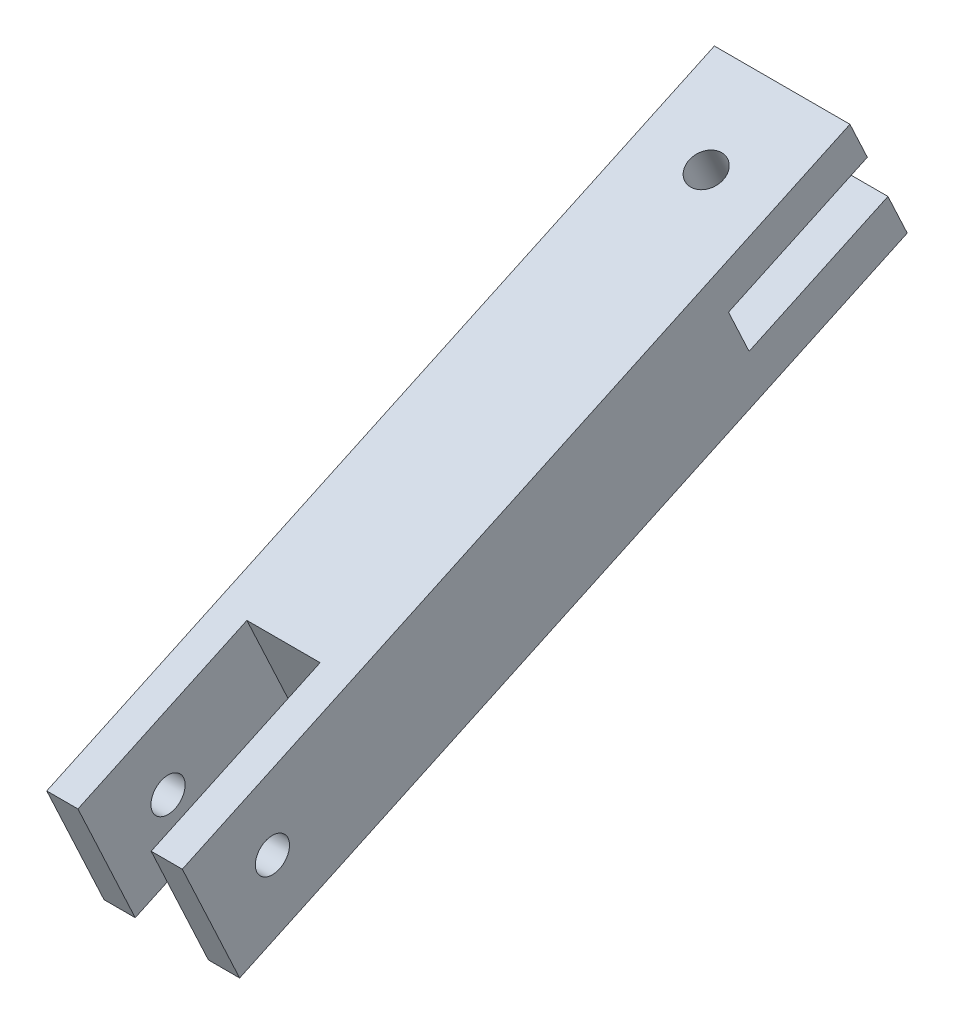
from build123d import *

# Parameters (mm, degrees)
BOSS_EXTRUDE5_START                  = -6.35
BOSS_EXTRUDE5_DEPTH                  = 12.7
M3_CLEARANCE_HOLE2_D                 = 3.2
CUT_EXTRUDE2_DEPTH                   = 12.7
BALL_START                           = -6.35
BALL_BALANCER_MASTER_MODEL_OUTLINE_R = 1.6
BALL_BALANCER_MASTER_MODEL_DEPTH     = 12.7


# Read off the part's stored shape, not the designer's step: Ball Balancer Master Model
with BuildPart() as part:
    # Sketch20 → Boss-Extrude5 (new body)
    with BuildSketch(Plane(origin=(0, 24.321911069, 11.341493392), x_dir=(0, -0.4226182617407002, 0.9063077870366497), z_dir=(0, 0.9063077870366496, 0.42261826174070016)).offset(BOSS_EXTRUDE5_START)):
        Polygon((114.700544477, -3.429), (97.238044477, -3.429), (97.238044477, 3.429), (114.700544477, 3.429), (114.700544477, 6.35), (45.701184477, 6.35), (45.701184477, -6.35), (114.700544477, -6.35), align=None)
    extrude(amount=BOSS_EXTRUDE5_DEPTH)

    # M3 Clearance Hole2 (through all)
    with Locations(Plane(origin=(0, 30.076965517, 14.025119355), x_dir=(1, 0, 0), z_dir=(0, 0.9063077870366494, 0.42261826174070066))):
        with Locations((0, -53.551184477)):
            Hole(M3_CLEARANCE_HOLE2_D / 2)

    # Sketch21 → Cut-Extrude2 (cut)
    with BuildSketch(Plane.ZY.offset(6.35)):
        Polygon((66.821464609, 1.208914252), (53.817107939, 7.272945357), (51.884897247, 3.129306154), (64.889253917, -2.93472495), align=None)
    extrude(amount=-CUT_EXTRUDE2_DEPTH, mode=Mode.SUBTRACT)

    # Ball Balancer Master Model outline → Ball Balancer Master Model (cut)
    with BuildSketch(Plane.YZ.offset(BALL_START)):
        with Locations((-21.469007696, 109.540435581)):
            Circle(BALL_BALANCER_MASTER_MODEL_OUTLINE_R)
    extrude(amount=BALL_BALANCER_MASTER_MODEL_DEPTH, mode=Mode.SUBTRACT)


solid = part.part
